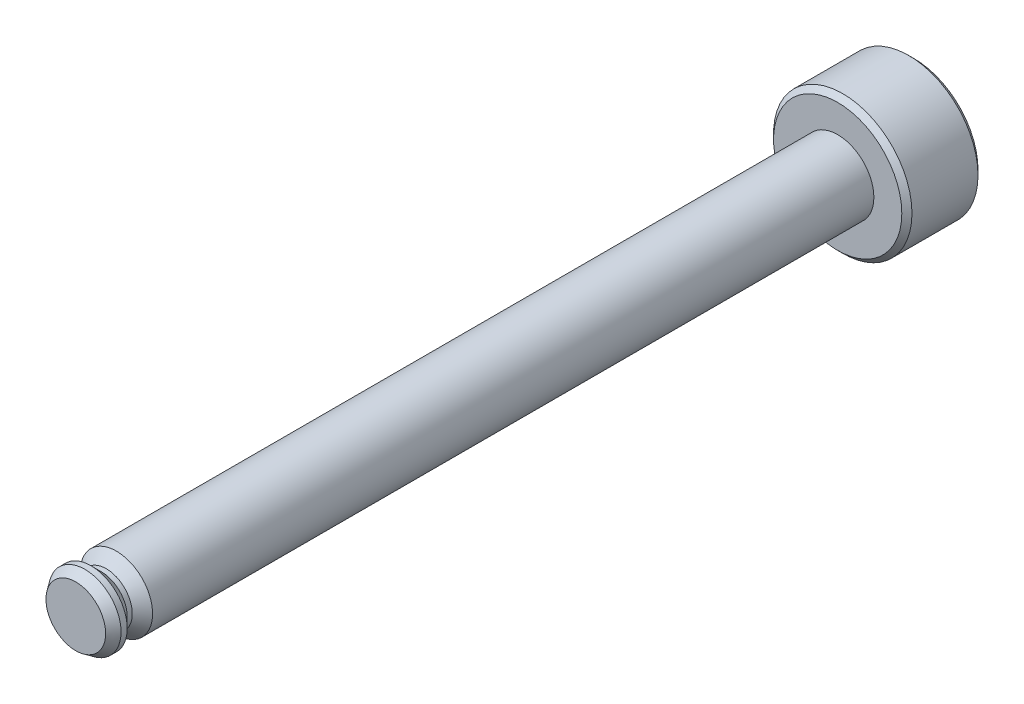
from build123d import *

# Parameters (mm, degrees)
SKETCH2_R      = 1.425
SHAFT_DEPTH    = 30
SKETCH5_R      = 2.725
HEAD_DEPTH     = 3
CHAMFER1_SIZE  = 0.25
CHAMFER1_SIZE2 = 0.357037002
DEBURS_SIZE    = 0.2


with BuildPart() as part:
    # Sketch2 → Shaft (new body)
    with BuildSketch(Plane.XY):
        Circle(SKETCH2_R)
    extrude(amount=SHAFT_DEPTH)

    # Sketch5 → Head (add)
    with BuildSketch(Plane.XY):
        Circle(SKETCH5_R)
    extrude(amount=-HEAD_DEPTH)

    # Chamfer1
    chamfer1_edges = [part.edges().sort_by_distance(p)[0] for p in [
        (-1.425, 0, 30),
    ]]
    chamfer1_side = [part.faces().sort_by_distance(p)[0] for p in [
        (0, 0, 30),
    ]]
    chamfer(chamfer1_edges, length=CHAMFER1_SIZE, length2=CHAMFER1_SIZE2, reference=chamfer1_side[0])

    # Deburs
    deburs_edges = [part.edges().sort_by_distance(p)[0] for p in [
        (-2.725, 0, 0),
        (-2.725, 0, -3),
    ]]
    chamfer(deburs_edges, length=DEBURS_SIZE)

    # Sketch6 → e-Clip Notch Long (revolve, cut)
    with BuildSketch(Plane(origin=(0, 0, 0), x_dir=(0, 0, -1), z_dir=(1, 0, 0))):
        Polygon((-29.4, 1.425), (-28.4, 1.425), (-28.8, 1.025), (-29, 1.025), align=None)
    revolve(axis=Axis((0, 0, 0), (0, 0, 1)), mode=Mode.SUBTRACT)


solid = part.part
